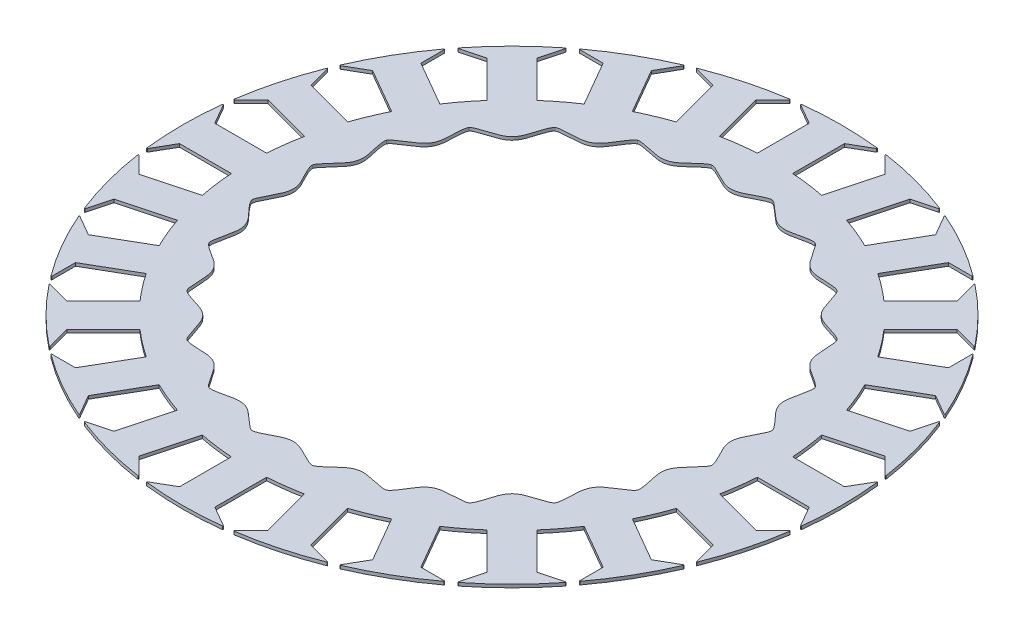
from build123d import *

# Parameters (mm, degrees)
BOSS_EXTRUDE1_DEPTH = 0.79375
CIRPATTERN1_COUNT   = 24


# Read off the part's stored shape, not the designer's step: Boss-Extrude1
with BuildPart() as part:
    # Boss-Extrude1 outline → Boss-Extrude1 (new body)
    with BuildSketch(Plane(origin=(0, 0, 0), x_dir=(1, 0, 0), z_dir=(0, 1, 0))):
        with BuildLine():
            add(Edge.make_bspline(
                [(-7.576764868, -57.551242906), (-6.87863394, -57.63885253), (-3, -56.047850313), (0, -52.047850313), (3, -56.047850313), (6.87863394, -57.63885253), (7.576764868, -57.551242906)],
                knots=[0, 0, 0, 0, 0, 0, 0.5, 1, 1, 1, 1, 1, 1], degree=5))
            Line((-7.576764868, -57.551242906), (-8.614728687, -65.435360851))
            ThreePointArc((-8.614728687, -65.435360851), (-6.519623436, -65.677199318), (-4.417860937, -65.85197419))
            Line((-4.417860937, -65.85197419), (-4.417860938, -78.825077913))
            Line((-4.417860938, -78.825077913), (-9.515106999, -81.767974299))
            ThreePointArc((-9.515106999, -81.767974299), (-9.563028572, -81.874858987), (-9.476593779, -81.953914918))
            ThreePointArc((-9.476593779, -81.953914918), (0, -82.5), (9.476593779, -81.953914918))
            ThreePointArc((9.476593779, -81.953914918), (9.563028572, -81.874858987), (9.515106999, -81.767974299))
            Line((9.515106999, -81.767974299), (4.417860937, -78.825077913))
            Line((4.417860937, -78.825077913), (4.417860938, -65.85197419))
            ThreePointArc((4.417860938, -65.85197419), (6.519623436, -65.677199318), (8.614728687, -65.435360851))
            Line((8.614728687, -65.435360851), (7.576764868, -57.551242906))
        make_face()
    extrude(amount=BOSS_EXTRUDE1_DEPTH)


with BuildPart() as cirpattern1_1:
    # CirPattern1: pattern copy
    add(part.part.rotate(Axis((0, 55.396875, 0), (0, -1, 0)), 1 * 360 / CIRPATTERN1_COUNT))


with BuildPart() as cirpattern1_2:
    # CirPattern1: pattern copy
    add(part.part.rotate(Axis((0, 55.396875, 0), (0, -1, 0)), 2 * 360 / CIRPATTERN1_COUNT))


with BuildPart() as cirpattern1_3:
    # CirPattern1: pattern copy
    add(part.part.rotate(Axis((0, 55.396875, 0), (0, -1, 0)), 3 * 360 / CIRPATTERN1_COUNT))


with BuildPart() as cirpattern1_4:
    # CirPattern1: pattern copy
    add(part.part.rotate(Axis((0, 55.396875, 0), (0, -1, 0)), 4 * 360 / CIRPATTERN1_COUNT))


with BuildPart() as cirpattern1_5:
    # CirPattern1: pattern copy
    add(part.part.rotate(Axis((0, 55.396875, 0), (0, -1, 0)), 5 * 360 / CIRPATTERN1_COUNT))


with BuildPart() as cirpattern1_6:
    # CirPattern1: pattern copy
    add(part.part.rotate(Axis((0, 55.396875, 0), (0, -1, 0)), 6 * 360 / CIRPATTERN1_COUNT))


with BuildPart() as cirpattern1_7:
    # CirPattern1: pattern copy
    add(part.part.rotate(Axis((0, 55.396875, 0), (0, -1, 0)), 7 * 360 / CIRPATTERN1_COUNT))


with BuildPart() as cirpattern1_8:
    # CirPattern1: pattern copy
    add(part.part.rotate(Axis((0, 55.396875, 0), (0, -1, 0)), 8 * 360 / CIRPATTERN1_COUNT))


with BuildPart() as cirpattern1_9:
    # CirPattern1: pattern copy
    add(part.part.rotate(Axis((0, 55.396875, 0), (0, -1, 0)), 9 * 360 / CIRPATTERN1_COUNT))


with BuildPart() as cirpattern1_10:
    # CirPattern1: pattern copy
    add(part.part.rotate(Axis((0, 55.396875, 0), (0, -1, 0)), 10 * 360 / CIRPATTERN1_COUNT))


with BuildPart() as cirpattern1_11:
    # CirPattern1: pattern copy
    add(part.part.rotate(Axis((0, 55.396875, 0), (0, -1, 0)), 11 * 360 / CIRPATTERN1_COUNT))


with BuildPart() as cirpattern1_12:
    # CirPattern1: pattern copy
    add(part.part.rotate(Axis((0, 55.396875, 0), (0, -1, 0)), 12 * 360 / CIRPATTERN1_COUNT))


with BuildPart() as cirpattern1_13:
    # CirPattern1: pattern copy
    add(part.part.rotate(Axis((0, 55.396875, 0), (0, -1, 0)), 13 * 360 / CIRPATTERN1_COUNT))


with BuildPart() as cirpattern1_14:
    # CirPattern1: pattern copy
    add(part.part.rotate(Axis((0, 55.396875, 0), (0, -1, 0)), 14 * 360 / CIRPATTERN1_COUNT))


with BuildPart() as cirpattern1_15:
    # CirPattern1: pattern copy
    add(part.part.rotate(Axis((0, 55.396875, 0), (0, -1, 0)), 15 * 360 / CIRPATTERN1_COUNT))


with BuildPart() as cirpattern1_16:
    # CirPattern1: pattern copy
    add(part.part.rotate(Axis((0, 55.396875, 0), (0, -1, 0)), 16 * 360 / CIRPATTERN1_COUNT))


with BuildPart() as cirpattern1_17:
    # CirPattern1: pattern copy
    add(part.part.rotate(Axis((0, 55.396875, 0), (0, -1, 0)), 17 * 360 / CIRPATTERN1_COUNT))


with BuildPart() as cirpattern1_18:
    # CirPattern1: pattern copy
    add(part.part.rotate(Axis((0, 55.396875, 0), (0, -1, 0)), 18 * 360 / CIRPATTERN1_COUNT))


with BuildPart() as cirpattern1_19:
    # CirPattern1: pattern copy
    add(part.part.rotate(Axis((0, 55.396875, 0), (0, -1, 0)), 19 * 360 / CIRPATTERN1_COUNT))


with BuildPart() as cirpattern1_20:
    # CirPattern1: pattern copy
    add(part.part.rotate(Axis((0, 55.396875, 0), (0, -1, 0)), 20 * 360 / CIRPATTERN1_COUNT))


with BuildPart() as cirpattern1_21:
    # CirPattern1: pattern copy
    add(part.part.rotate(Axis((0, 55.396875, 0), (0, -1, 0)), 21 * 360 / CIRPATTERN1_COUNT))


with BuildPart() as cirpattern1_22:
    # CirPattern1: pattern copy
    add(part.part.rotate(Axis((0, 55.396875, 0), (0, -1, 0)), 22 * 360 / CIRPATTERN1_COUNT))


with BuildPart() as cirpattern1_23:
    # CirPattern1: pattern copy
    add(part.part.rotate(Axis((0, 55.396875, 0), (0, -1, 0)), 23 * 360 / CIRPATTERN1_COUNT))


with BuildPart() as part_1:
    add(part.part)

    # Combine1: union CirPattern1_1, CirPattern1_2, CirPattern1_3, CirPattern1_4, CirPattern1_5, CirPattern1_6, CirPattern1_7, CirPattern1_8, CirPattern1_9, CirPattern1_10, CirPattern1_11, CirPattern1_12, CirPattern1_13, CirPattern1_14, CirPattern1_15, CirPattern1_16, CirPattern1_17, CirPattern1_18, CirPattern1_19, CirPattern1_20, CirPattern1_21, CirPattern1_22, CirPattern1_23
    add(cirpattern1_1.part)
    add(cirpattern1_2.part)
    add(cirpattern1_3.part)
    add(cirpattern1_4.part)
    add(cirpattern1_5.part)
    add(cirpattern1_6.part)
    add(cirpattern1_7.part)
    add(cirpattern1_8.part)
    add(cirpattern1_9.part)
    add(cirpattern1_10.part)
    add(cirpattern1_11.part)
    add(cirpattern1_12.part)
    add(cirpattern1_13.part)
    add(cirpattern1_14.part)
    add(cirpattern1_15.part)
    add(cirpattern1_16.part)
    add(cirpattern1_17.part)
    add(cirpattern1_18.part)
    add(cirpattern1_19.part)
    add(cirpattern1_20.part)
    add(cirpattern1_21.part)
    add(cirpattern1_22.part)
    add(cirpattern1_23.part)


solid = part_1.part
